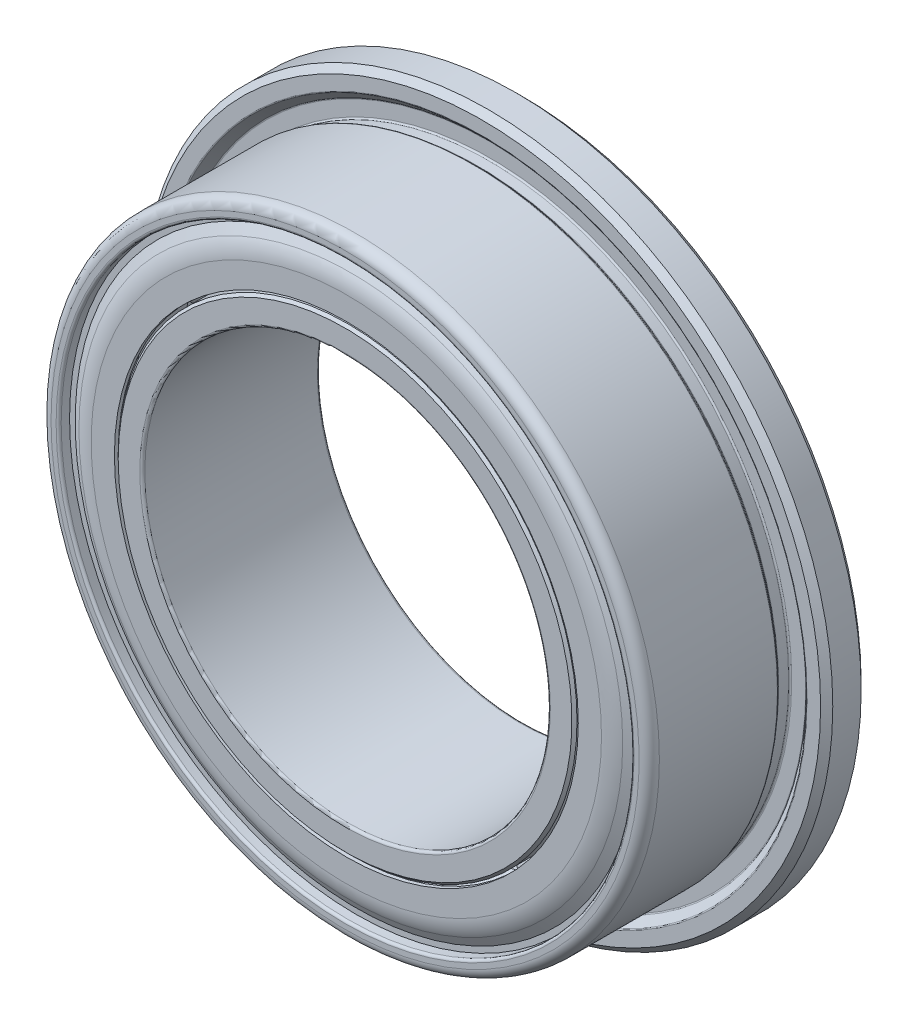
from build123d import *

# Parameters (mm, degrees)
CIRPATTERN1_COUNT  = 12
SKETCH9_R          = 4.575
CUT_EXTRUDE1_DEPTH = 10.169276144
SKETCH7_W          = 0.8
SKETCH7_H          = 1.15
FILLET2_R          = 0.2
FILLET3_R          = 0.05
FILLET5_R          = 0.03
CHAMFER1_SIZE      = 0.12
FILLET7_R          = 0.05


with BuildPart() as part:
    # Sketch3 → Revolve1 (revolve)
    with BuildSketch(Plane(origin=(0, 0, 0), x_dir=(0, 0, -1), z_dir=(1, 0, 0)), mode=Mode.PRIVATE) as revolve1_sk:
        with BuildLine():
            Line((-1.75, 6), (-1.75, 5.65))
            Line((-1.75, 5.65), (-0.645041637, 5.65))
            Line((-0.645041637, 5.65), (-0.645041637, 5.425))
            Line((-0.645041637, 5.425), (-0.445041637, 5.425))
            ThreePointArc((-0.445041637, 5.425), (0, 5.609087518), (0.445041637, 5.425))
            Line((0.445041637, 5.425), (0.645041637, 5.425))
            Line((0.645041637, 5.425), (0.645041637, 5.65))
            Line((0.645041637, 5.65), (1.75, 5.65))
            Line((1.75, 5.65), (1.75, 6))
            Line((1.75, 6), (-1.75, 6))
        make_face()
        with BuildLine():
            Line((1.75, 4), (-1.75, 4))
            Line((-1.75, 4), (-1.75, 4.525))
            Line((-1.75, 4.525), (-0.445041637, 4.525))
            ThreePointArc((-0.445041637, 4.525), (0, 4.349087518), (0.445041637, 4.525))
            Line((0.445041637, 4.525), (1.75, 4.525))
            Line((1.75, 4.525), (1.75, 4))
        make_face()
    revolve(revolve1_sk.sketch.rotate(Axis((0, 0, 1.75), (0, 0, -1)), 90), axis=Axis((0, 0, 1.75), (0, 0, -1)))

    # Sketch7 → Revolve5 (revolve)
    with BuildSketch(Plane(origin=(0, 0, 0), x_dir=(0, 0, -1), z_dir=(1, 0, 0)), mode=Mode.PRIVATE) as revolve5_sk:
        with Locations((1.35, 6.225)):
            Rectangle(SKETCH7_W, SKETCH7_H)
    revolve(revolve5_sk.sketch.rotate(Axis((0, 0, -1.75), (0, 0, 1)), 270), axis=Axis((0, 0, -1.75), (0, 0, 1)))

    # Fillet2
    fillet2_edges = [part.edges().sort_by_distance(p)[0] for p in [
        (-6, 0, 1.75),
    ]]
    fillet(fillet2_edges, radius=FILLET2_R)

    # Fillet3
    fillet3_edges = [part.edges().sort_by_distance(p)[0] for p in [
        (-5.65, 0, 0.645041637),
        (-5.65, 0, 1.75),
        (-5.65, 0, -1.75),
        (-5.65, 0, -0.645041637),
    ]]
    fillet(fillet3_edges, radius=FILLET3_R)

    # Fillet6
    # the kernel refuses this chamfer: 0.05 mm, written as the material it takes off along each edge
    with BuildSketch(Plane(origin=(0, 0, 1.75), x_dir=(1, 0, 0), z_dir=(0, 1, 0))) as fillet6_piece_1:
        with BuildLine():
            Line((4.473585786, -0.001414214), (4.526414214, 0.051414214))
            Line((4.526414214, 0.051414214), (4.527414214, 0.051414214))
            ThreePointArc((4.527414214, 0.051414214), (4.526, 0.025707107), (4.526, 0))
            Line((4.526, 0), (4.525, -0.001))
            ThreePointArc((4.525, -0.001), (4.499292893, -0.001), (4.473585786, -0.002414214))
            Line((4.473585786, -0.002414214), (4.473585786, -0.001414214))
        make_face()
    revolve(axis=Axis((0, 0, 1.75), (0, 0, -1)), mode=Mode.SUBTRACT)
    with BuildSketch(Plane(origin=(0, 0, 0.445041637), x_dir=(1, 0, 0), z_dir=(0, 1, 0))) as fillet6_piece_2:
        with BuildLine():
            Line((4.525708486, -0.021213539), (4.511742694, 0.015654239))
            Line((4.511742694, 0.015654239), (4.512491718, 0.016316783))
            ThreePointArc((4.512491718, 0.016316783), (4.518790675, 0.008207779), (4.525729745, 0.00068372))
            Line((4.525729745, 0.00068372), (4.526, 0))
            ThreePointArc((4.526, 0), (4.526, -0.01060677), (4.526708486, -0.021213539))
            Line((4.526708486, -0.021213539), (4.525708486, -0.021213539))
        make_face()
    revolve(axis=Axis((0, 0, 0.445041637), (0, 0, -1)), mode=Mode.SUBTRACT)
    with BuildSketch(Plane(origin=(0, 0, -0.445041637), x_dir=(1, 0, 0), z_dir=(0, 1, 0))) as fillet6_piece_3:
        with BuildLine():
            Line((4.525708486, 0.021213539), (4.511742694, -0.015654239))
            Line((4.511742694, -0.015654239), (4.512491718, -0.016316783))
            ThreePointArc((4.512491718, -0.016316783), (4.518790675, -0.008207779), (4.525729745, -0.00068372))
            Line((4.525729745, -0.00068372), (4.526, 0))
            ThreePointArc((4.526, 0), (4.526, 0.01060677), (4.526708486, 0.021213539))
            Line((4.526708486, 0.021213539), (4.525708486, 0.021213539))
        make_face()
    revolve(axis=Axis((0, 0, -0.445041637), (0, 0, -1)), mode=Mode.SUBTRACT)
    with BuildSketch(Plane(origin=(0, 0, -1.75), x_dir=(1, 0, 0), z_dir=(0, 1, 0))) as fillet6_piece_4:
        with BuildLine():
            Line((4.526414214, -0.051414214), (4.473585786, 0.001414214))
            Line((4.473585786, 0.001414214), (4.473585786, 0.002414214))
            ThreePointArc((4.473585786, 0.002414214), (4.499292893, 0.001), (4.525, 0.001))
            Line((4.525, 0.001), (4.526, 0))
            ThreePointArc((4.526, 0), (4.526, -0.025707107), (4.527414214, -0.051414214))
            Line((4.527414214, -0.051414214), (4.526414214, -0.051414214))
        make_face()
    revolve(axis=Axis((0, 0, -1.75), (0, 0, -1)), mode=Mode.SUBTRACT)

    # Sketch8 → Cut-Revolve1 (revolve, cut)
    with BuildSketch(Plane(origin=(0, 0, 0), x_dir=(0, 0, -1), z_dir=(1, 0, 0)), mode=Mode.PRIVATE) as cut_revolve1_sk:
        Polygon((0.95, 6.4), (1.11, 6.24), (1.11, 5.92), (0.87, 5.92), (0.79, 6), (0.95, 6), align=None)
    revolve(cut_revolve1_sk.sketch.rotate(Axis((0, 0, 1.75), (0, 0, -1)), 270), axis=Axis((0, 0, 1.75), (0, 0, -1)), mode=Mode.SUBTRACT)

    # Fillet5
    fillet5_edges = [part.edges().sort_by_distance(p)[0] for p in [
        (6.4, 0, -0.95),
        (0, 6, -0.79),
        (5.92, 0, -0.87),
        (5.92, 0, -1.11),
        (6.24, 0, -1.11),
    ]]
    fillet(fillet5_edges, radius=FILLET5_R)

    # Chamfer1
    chamfer1_edges = [part.edges().sort_by_distance(p)[0] for p in [
        (-6.8, 0, -1.75),
        (-6.8, 0, -0.95),
    ]]
    chamfer(chamfer1_edges, length=CHAMFER1_SIZE)

    # Fillet7
    fillet7_edges = [part.edges().sort_by_distance(p)[0] for p in [
        (-4, 0, -1.75),
        (-4, 0, 1.75),
    ]]
    fillet(fillet7_edges, radius=FILLET7_R)


with BuildPart() as body_2:
    # Sketch5 → Revolve3 (revolve)
    with BuildSketch(Plane(origin=(0, 0, 0), x_dir=(0, 0, -1), z_dir=(1, 0, 0))):
        with BuildLine():
            Line((-0.6, 4.979087518), (0.6, 4.979087518))
            ThreePointArc((0.6, 4.979087518), (0, 5.579087518), (-0.6, 4.979087518))
        make_face()
    revolve(axis=Axis((0, 4.979087518, 0.6), (0, 0, -1)))


with BuildPart() as cirpattern1_1:
    # CirPattern1: pattern copy
    add(body_2.part.rotate(Axis((0, 0, 0), (0, 0, 1)), 1 * 360 / CIRPATTERN1_COUNT))


with BuildPart() as cirpattern1_2:
    # CirPattern1: pattern copy
    add(body_2.part.rotate(Axis((0, 0, 0), (0, 0, 1)), 2 * 360 / CIRPATTERN1_COUNT))


with BuildPart() as cirpattern1_3:
    # CirPattern1: pattern copy
    add(body_2.part.rotate(Axis((0, 0, 0), (0, 0, 1)), 3 * 360 / CIRPATTERN1_COUNT))


with BuildPart() as cirpattern1_4:
    # CirPattern1: pattern copy
    add(body_2.part.rotate(Axis((0, 0, 0), (0, 0, 1)), 4 * 360 / CIRPATTERN1_COUNT))


with BuildPart() as cirpattern1_5:
    # CirPattern1: pattern copy
    add(body_2.part.rotate(Axis((0, 0, 0), (0, 0, 1)), 5 * 360 / CIRPATTERN1_COUNT))


with BuildPart() as cirpattern1_6:
    # CirPattern1: pattern copy
    add(body_2.part.rotate(Axis((0, 0, 0), (0, 0, 1)), 6 * 360 / CIRPATTERN1_COUNT))


with BuildPart() as cirpattern1_7:
    # CirPattern1: pattern copy
    add(body_2.part.rotate(Axis((0, 0, 0), (0, 0, 1)), 7 * 360 / CIRPATTERN1_COUNT))


with BuildPart() as cirpattern1_8:
    # CirPattern1: pattern copy
    add(body_2.part.rotate(Axis((0, 0, 0), (0, 0, 1)), 8 * 360 / CIRPATTERN1_COUNT))


with BuildPart() as cirpattern1_9:
    # CirPattern1: pattern copy
    add(body_2.part.rotate(Axis((0, 0, 0), (0, 0, 1)), 9 * 360 / CIRPATTERN1_COUNT))


with BuildPart() as cirpattern1_10:
    # CirPattern1: pattern copy
    add(body_2.part.rotate(Axis((0, 0, 0), (0, 0, 1)), 10 * 360 / CIRPATTERN1_COUNT))


with BuildPart() as cirpattern1_11:
    # CirPattern1: pattern copy
    add(body_2.part.rotate(Axis((0, 0, 0), (0, 0, 1)), 11 * 360 / CIRPATTERN1_COUNT))


with BuildPart() as body_14:
    # Sketch6 → Revolve4 (revolve)
    with BuildSketch(Plane(origin=(0, 0, 0), x_dir=(0, 0, -1), z_dir=(1, 0, 0)), mode=Mode.PRIVATE) as revolve4_sk:
        with BuildLine():
            Line((-1.725, 4.525), (-1.725, 5.033153533))
            ThreePointArc((-1.725, 5.033153533), (-1.702511045, 5.203974103), (-1.636576766, 5.363153533))
            Line((-1.636576766, 5.363153533), (-1.534474411, 5.54))
            Line((-1.534474411, 5.54), (-1.534474411, 5.65))
            Line((-1.534474411, 5.65), (-1.447871871, 5.65))
            Line((-1.447871871, 5.65), (-1.447871871, 5.54))
            Line((-1.447871871, 5.54), (-1.65, 5.189903811))
            Line((-1.65, 5.189903811), (-1.65, 4.525))
            Line((-1.65, 4.525), (-1.725, 4.525))
        make_face()
    revolve(revolve4_sk.sketch.rotate(Axis((0, 0, 1.75), (0, 0, -1)), 90), axis=Axis((0, 0, 1.75), (0, 0, -1)))


with BuildPart() as body_15:
    # Mirror1: mirrored copy
    add(body_14.part.mirror(Plane.XY))


with BuildPart() as cut_extrude1_tool:
    # Sketch9 → Cut-Extrude1 (new, through all)
    with BuildSketch(Plane.XY.offset(1.725)):
        Circle(SKETCH9_R)
    extrude(amount=-CUT_EXTRUDE1_DEPTH)


with BuildPart() as body_14_1:
    add(body_14.part)

    # Cut-Extrude1: cut by cut_extrude1_tool
    add(cut_extrude1_tool.part, mode=Mode.SUBTRACT)


with BuildPart() as body_15_1:
    add(body_15.part)

    # Cut-Extrude1: cut by cut_extrude1_tool
    add(cut_extrude1_tool.part, mode=Mode.SUBTRACT)


solid = Compound([part.part, body_2.part, cirpattern1_1.part, cirpattern1_2.part, cirpattern1_3.part, cirpattern1_4.part, cirpattern1_5.part, cirpattern1_6.part, cirpattern1_7.part, cirpattern1_8.part, cirpattern1_9.part, cirpattern1_10.part, cirpattern1_11.part, body_14_1.part, body_15_1.part])
